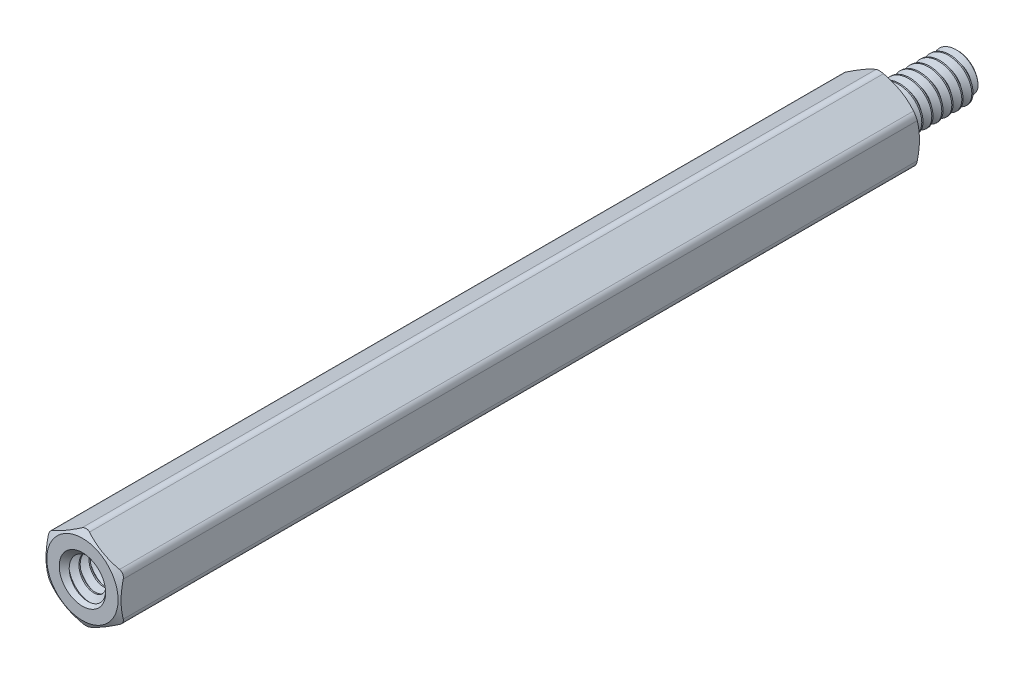
from build123d import *

# Parameters (mm, degrees)
SKETCH4_R           = 1.901825
BOSS_EXTRUDE1_DEPTH = 50.8
SKETCH5_OUTSIDE_W   = 214.32
SKETCH5_OUTSIDE_H   = 215.058
SKETCH5_OUTSIDE_R   = 2.2621875
CUT_EXTRUDE1_DEPTH  = 56.681435206
CUT_EXTRUDE1_DRAFT  = -60
SKETCH6_OUTSIDE_W   = 197.86
SKETCH6_OUTSIDE_H   = 198.598
SKETCH6_OUTSIDE_R   = 2.2621875
CUT_EXTRUDE2_DEPTH  = 51.930058122
CUT_EXTRUDE2_DRAFT  = -60
FILLET1_R           = 0.47625
CUT_SWEEP1_PITCH    = 0.635
SKETCH9_R           = 1.58115
BOSS_EXTRUDE2_DEPTH = 6.35
SKETCH10_W          = 6.35
SKETCH10_H          = 1.4224
CUT_SWEEP2_PITCH    = 0.635


with BuildPart() as part:
    # Sketch3 → Revolve1 (revolve)
    with BuildSketch(Plane(origin=(0, 0, 0), x_dir=(0, 0, -1), z_dir=(1, 0, 0))):
        with BuildLine():
            Line((-44.45, 1.26365), (-44.45, 0))
            Line((-44.45, 0), (4.7625, 0))
            Line((4.7625, 0), (4.7625, 1.26365))
            Line((4.7625, 1.26365), (4.60375, 1.4224))
            Line((4.60375, 1.4224), (0.809625, 1.4224))
            Line((0.809625, 1.4224), (0.5715, 1.009955401))
            Line((0.5715, 1.009955401), (0.15875, 1.009955401))
            ThreePointArc((0.15875, 1.009955401), (0.046496798, 1.0564522), (0, 1.168705401))
            Line((0, 1.168705401), (0, 2.38125))
            Line((0, 2.38125), (-50.8, 2.38125))
            Line((-50.8, 2.38125), (-50.8, 1.58115))
            Line((-50.8, 1.58115), (-50.64125, 1.4224))
            Line((-50.64125, 1.4224), (-44.60875, 1.4224))
            Line((-44.60875, 1.4224), (-44.45, 1.26365))
        make_face()
    revolve(axis=Axis((0, 0, -4.7625), (0, 0, 1)))

    # Sketch4 → Boss-Extrude1 (add)
    with BuildSketch(Plane.XY.offset(50.8)):
        Polygon((-2.38125, 1.374815329), (-2.38125, -1.374815329), (0, -2.749630657), (2.38125, -1.374815329), (2.38125, 1.374815329), (0, 2.749630657), align=None)
        Circle(SKETCH4_R, mode=Mode.SUBTRACT)
    extrude(amount=-BOSS_EXTRUDE1_DEPTH)


with BuildPart() as cut_extrude1_tool:
    # Sketch5 outside → Cut-Extrude1 (with draft: the straight prism first)
    with BuildSketch(Plane.XY.offset(50.8)):
        Rectangle(SKETCH5_OUTSIDE_W, SKETCH5_OUTSIDE_H)
        Circle(SKETCH5_OUTSIDE_R, mode=Mode.SUBTRACT)
    extrude(amount=-CUT_EXTRUDE1_DEPTH)
    # Cut-Extrude1: the draft: its side faces are tilted about the plane it starts from
    cut_extrude1_sides = [cut_extrude1_tool.faces().sort_by_distance(p)[0] for p in [
        (0, -107.529, 22.459282397),
        (107.16, 0, 22.459282397),
        (0, 107.529, 22.459282397),
        (-107.16, 0, 22.459282397),
        (-2.2621875, 0, 22.459282397),
    ]]
    draft(cut_extrude1_sides, Plane.XY.offset(50.8), CUT_EXTRUDE1_DRAFT)


with BuildPart() as part_1:
    add(part.part)

    # Cut-Extrude1: cut by cut_extrude1_tool
    add(cut_extrude1_tool.part, mode=Mode.SUBTRACT)


with BuildPart() as cut_extrude2_tool:
    # Sketch6 outside → Cut-Extrude2 (with draft: the straight prism first)
    with BuildSketch(Plane(origin=(0, 0, 0), x_dir=(-1, 0, 0), z_dir=(0, 0, -1))):
        Rectangle(SKETCH6_OUTSIDE_W, SKETCH6_OUTSIDE_H)
        Circle(SKETCH6_OUTSIDE_R, mode=Mode.SUBTRACT)
    extrude(amount=-CUT_EXTRUDE2_DEPTH)
    # Cut-Extrude2: the draft: its side faces are tilted about the plane it starts from
    cut_extrude2_sides = [cut_extrude2_tool.faces().sort_by_distance(p)[0] for p in [
        (0, -99.299, 25.965029061),
        (-98.93, 0, 25.965029061),
        (0, 99.299, 25.965029061),
        (98.93, 0, 25.965029061),
        (2.2621875, 0, 25.965029061),
    ]]
    draft(cut_extrude2_sides, Plane(origin=(0, 0, 0), x_dir=(-1, 0, 0), z_dir=(0, 0, -1)), CUT_EXTRUDE2_DRAFT)


with BuildPart() as part_2:
    add(part_1.part)

    # Cut-Extrude2: cut by cut_extrude2_tool
    add(cut_extrude2_tool.part, mode=Mode.SUBTRACT)

    # Fillet1
    fillet1_edges = [part_2.edges().sort_by_distance(p)[0] for p in [
        (0, 2.749630657, 25.4),
        (-2.38125, -1.374815329, 25.4),
        (0, -2.749630657, 25.4),
        (2.38125, -1.374815329, 25.4),
        (2.38125, 1.374815329, 25.4),
        (-2.38125, 1.374815329, 25.4),
    ]]
    fillet(fillet1_edges, radius=FILLET1_R)

    # Cut-Sweep1: the profile of Sketch7 profile screwed along a right-hand helix of 7.275 turns, 6 arcs to a turn; built about Z, then put on its axis
    cut_sweep1_z = Axis((0, 0, 0), (0, 0, 1))
    cut_sweep1_corners = [(1.009655401, 0, -0.238298205), (1.009655401, 0, -0.317326795), (1.456770383, 0, -0.57546875), (1.456770383, 0, 0.01984375)]
    with BuildLine(mode=Mode.PRIVATE) as cut_sweep1_profile:
        Line(cut_sweep1_corners[0], cut_sweep1_corners[1])
        Line(cut_sweep1_corners[1], cut_sweep1_corners[2])
        Line(cut_sweep1_corners[2], cut_sweep1_corners[3])
        Line(cut_sweep1_corners[3], cut_sweep1_corners[0])
    cut_sweep1_cap = Face(cut_sweep1_profile.wire())
    cut_sweep1_turn_angles = [0, 30, 60, 90, 120, 150, 180, 210, 240, 270, 300, 330, 360]
    cut_sweep1_turn_weights = [1, 0.8660254037844387, 1, 0.8660254037844387, 1, 0.8660254037844387, 1, 0.8660254037844387, 1, 0.8660254037844387, 1, 0.8660254037844387, 1]
    cut_sweep1_turn_rails = [Edge.make_bspline([Vector(p[0], p[1], 0).rotate(cut_sweep1_z, cut_sweep1_turn_angles[k]) / cut_sweep1_turn_weights[k] + Vector(0, 0, p[2] + CUT_SWEEP1_PITCH * cut_sweep1_turn_angles[k] / 360) for k in range(13)], [0, 0, 0, 1, 1, 2, 2, 3, 3, 4, 4, 5, 5, 6, 6, 6], 2, cut_sweep1_turn_weights) for p in cut_sweep1_corners]
    cut_sweep1_turn_sides = [Face.make_surface_from_curves(cut_sweep1_turn_rails[p[0]], cut_sweep1_turn_rails[p[1]]) for p in [(0, 1), (1, 2), (2, 3), (3, 0)]]
    cut_sweep1_last_angles = [2520, 2550, 2580, 2599.5, 2619]
    cut_sweep1_last_weights = [1, 0.8660254037844387, 1, 0.9426414910921811, 1]
    cut_sweep1_last_rails = [Edge.make_bspline([Vector(p[0], p[1], 0).rotate(cut_sweep1_z, cut_sweep1_last_angles[k]) / cut_sweep1_last_weights[k] + Vector(0, 0, p[2] + CUT_SWEEP1_PITCH * cut_sweep1_last_angles[k] / 360) for k in range(5)], [0, 0, 0, 1, 1, 2, 2, 2], 2, cut_sweep1_last_weights) for p in cut_sweep1_corners]
    cut_sweep1_last_sides = [Face.make_surface_from_curves(cut_sweep1_last_rails[p[0]], cut_sweep1_last_rails[p[1]]) for p in [(0, 1), (1, 2), (2, 3), (3, 0)]]
    cut_sweep1 = Plane(origin=(0, 0, -4.7625), x_dir=(0, 1, 0), z_dir=(0, 0, 1)) * Solid(Shell([*[p.moved(Location((0, 0, CUT_SWEEP1_PITCH * i))) for i in range(7) for p in cut_sweep1_turn_sides], *cut_sweep1_last_sides, cut_sweep1_cap, cut_sweep1_cap.rotate(cut_sweep1_z, 2619).moved(Location((0, 0, CUT_SWEEP1_PITCH * 2619 / 360)))]))
    add(cut_sweep1, mode=Mode.SUBTRACT)

    # Sketch9 → Boss-Extrude2 (add)
    with BuildSketch(Plane.XY.offset(44.45)):
        Circle(SKETCH9_R)
    extrude(amount=BOSS_EXTRUDE2_DEPTH)


with BuildPart() as body_2:
    # Sketch10 → Revolve2 (revolve)
    with BuildSketch(Plane(origin=(0, 0, 0), x_dir=(0, 0, -1), z_dir=(1, 0, 0))):
        with Locations((-47.625, 0.7112)):
            Rectangle(SKETCH10_W, SKETCH10_H)
    revolve(axis=Axis((0, 0, -4.7625), (0, 0, 1)))

    # Cut-Sweep2: the profile of Sketch12 profile screwed along a right-hand helix of 11 turns, 6 arcs to a turn; built about Z, then put on its axis
    cut_sweep2_z = Axis((0, 0, 0), (0, 0, 1))
    cut_sweep2_corners = [(1.009655401, 0, -0.317326795), (1.009655401, 0, -0.238298205), (1.456770383, 0, 0.01984375), (1.456770383, 0, -0.57546875)]
    with BuildLine(mode=Mode.PRIVATE) as cut_sweep2_profile:
        Line(cut_sweep2_corners[0], cut_sweep2_corners[1])
        Line(cut_sweep2_corners[1], cut_sweep2_corners[2])
        Line(cut_sweep2_corners[2], cut_sweep2_corners[3])
        Line(cut_sweep2_corners[3], cut_sweep2_corners[0])
    cut_sweep2_cap = Face(cut_sweep2_profile.wire())
    cut_sweep2_turn_angles = [0, 30, 60, 90, 120, 150, 180, 210, 240, 270, 300, 330, 360]
    cut_sweep2_turn_weights = [1, 0.8660254037844387, 1, 0.8660254037844387, 1, 0.8660254037844387, 1, 0.8660254037844387, 1, 0.8660254037844387, 1, 0.8660254037844387, 1]
    cut_sweep2_turn_rails = [Edge.make_bspline([Vector(p[0], p[1], 0).rotate(cut_sweep2_z, cut_sweep2_turn_angles[k]) / cut_sweep2_turn_weights[k] + Vector(0, 0, p[2] + CUT_SWEEP2_PITCH * cut_sweep2_turn_angles[k] / 360) for k in range(13)], [0, 0, 0, 1, 1, 2, 2, 3, 3, 4, 4, 5, 5, 6, 6, 6], 2, cut_sweep2_turn_weights) for p in cut_sweep2_corners]
    cut_sweep2_turn_sides = [Face.make_surface_from_curves(cut_sweep2_turn_rails[p[0]], cut_sweep2_turn_rails[p[1]]) for p in [(0, 1), (1, 2), (2, 3), (3, 0)]]
    cut_sweep2 = Plane(origin=(0, 0, 50.8), x_dir=(0, 1, 0), z_dir=(0, 0, -1)) * Solid(Shell([*[p.moved(Location((0, 0, CUT_SWEEP2_PITCH * i))) for i in range(11) for p in cut_sweep2_turn_sides], cut_sweep2_cap, cut_sweep2_cap.rotate(cut_sweep2_z, 3960).moved(Location((0, 0, CUT_SWEEP2_PITCH * 3960 / 360)))]))
    add(cut_sweep2, mode=Mode.SUBTRACT)


with BuildPart() as part_3:
    add(part_2.part)

    # Combine1: cut body 2
    add(body_2.part, mode=Mode.SUBTRACT)

    # Cut-Extrude3 cone 1 section (through the dimple's axis) → Cut-Extrude3 (revolve, cut)
    with BuildSketch(Plane(origin=(0, 0, 50.8), x_dir=(0, -1, 0), z_dir=(1, 0, 0))):
        Polygon((0, 0), (1.4732, 0), (0, 1.4732), align=None)
    revolve(axis=Axis((0, 0, 50.8), (0, 0, -1)), mode=Mode.SUBTRACT)


solid = part_3.part
